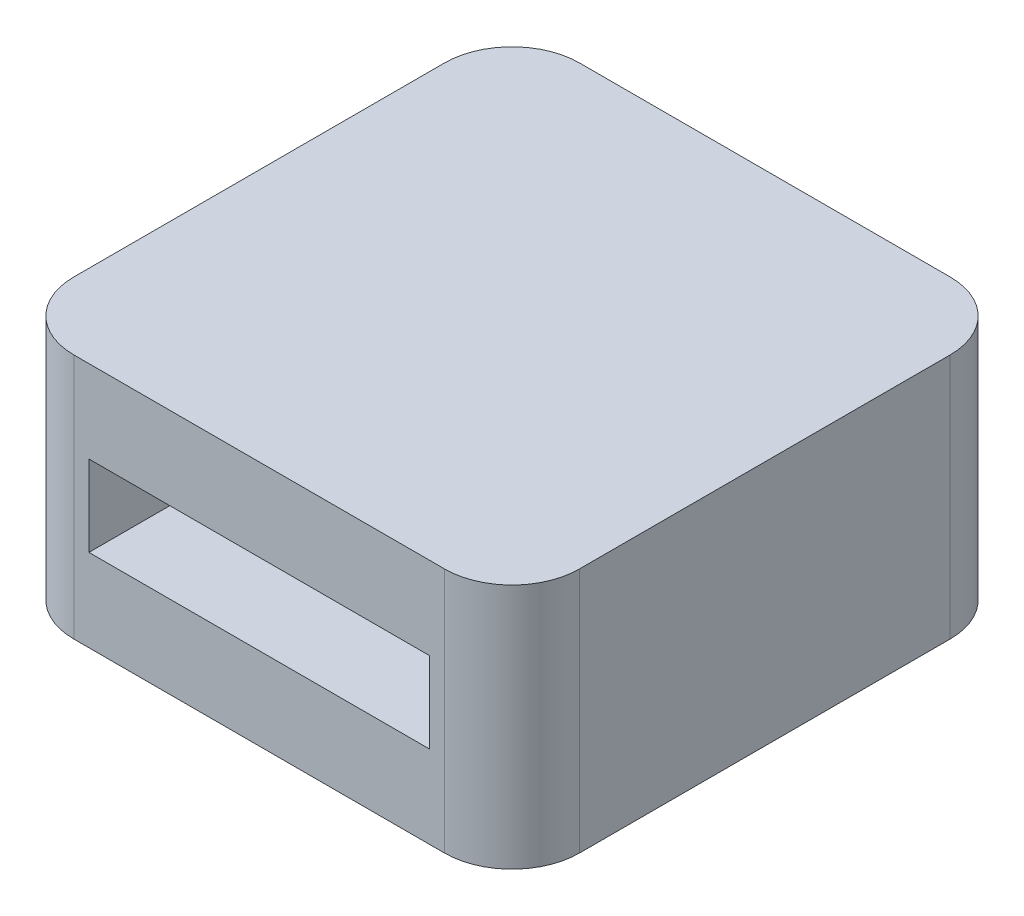
from build123d import *

# Parameters (mm, degrees)
PROFILE_SKETCH_W      = 15
PROFILE_SKETCH_H      = 7.3
PROFILE_SKETCH_W_2    = 10.1
PROFILE_SKETCH_H_2    = 2.4
PROFILE_EXTRUDE_DEPTH = 15
CORNER_FILLETS_R      = 2


with BuildPart() as part:
    # Profile Sketch → Profile Extrude (new body)
    with BuildSketch(Plane.XY):
        Rectangle(PROFILE_SKETCH_W, PROFILE_SKETCH_H)
        Rectangle(PROFILE_SKETCH_W_2, PROFILE_SKETCH_H_2, mode=Mode.SUBTRACT)
    extrude(amount=PROFILE_EXTRUDE_DEPTH)

    # Corner Fillets
    corner_fillets_edges = [part.edges().sort_by_distance(p)[0] for p in [
        (-7.5, 0, 0),
        (7.5, 0, 0),
        (7.5, 0, 15),
        (-7.5, 0, 15),
    ]]
    fillet(corner_fillets_edges, radius=CORNER_FILLETS_R)


solid = part.part
